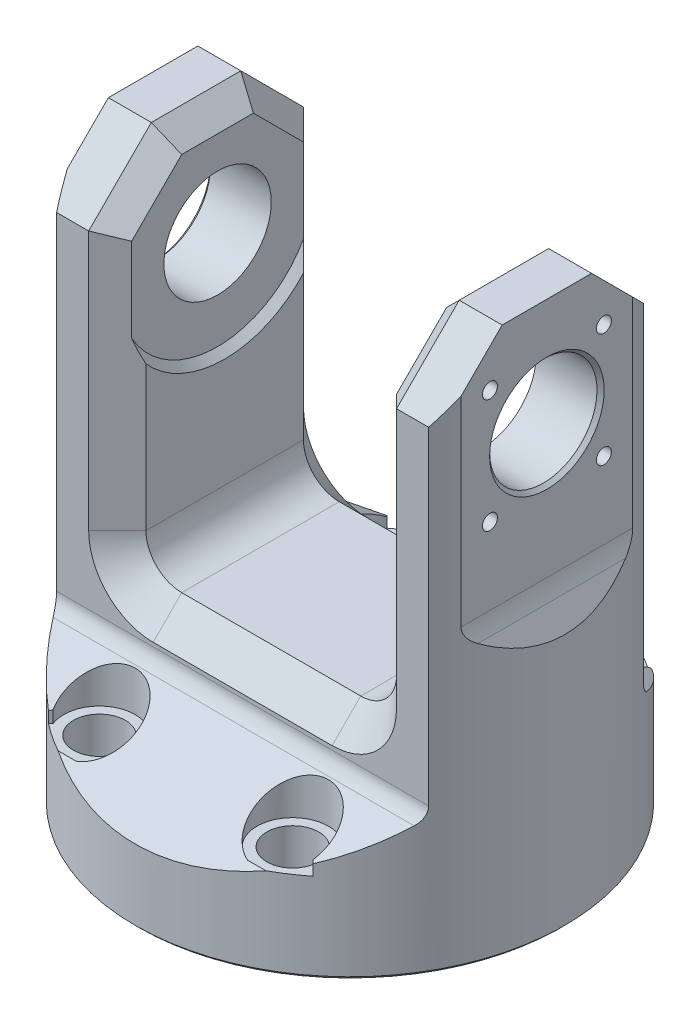
from build123d import *

# Parameters (mm, degrees)
SKETCH1_R               = 60
BOSS_EXTRUDE1_DEPTH     = 150
CUT_EXTRUDE1_DEPTH      = 173.336879396
CUT_EXTRUDE1_DEPTH_BACK = 173.336879396
SKETCH2_W               = 70
SKETCH2_H               = 100
FILLET1_R               = 10
CUT_EXTRUDE2_DEPTH      = 173.336879553
CUT_EXTRUDE2_DEPTH_BACK = 173.336879553
SKETCH3_OUTSIDE_W       = 167.3
SKETCH3_OUTSIDE_H       = 197.3
CUT_EXTRUDE3_DEPTH      = 199.305320239
CUT_EXTRUDE3_DEPTH_BACK = 199.305320239
SKETCH4_R               = 15
CIRPATTERN1_COUNT       = 4
CHAMFER1_SIZE           = 8
HOLE1_D                 = 14.5
HOLE1_CBORE_D           = 20
HOLE1_CBORE_DEPTH       = 25
CHAMFER3_SIZE           = 1
CHAMFER4_SIZE           = 1


with BuildPart() as part:
    # Sketch1 → Boss-Extrude1 (new body)
    with BuildSketch(Plane(origin=(0, 0, 0), x_dir=(1, 0, 0), z_dir=(0, 1, 0))):
        with Locations(Location((0, 0, 0), (0, 0, 270))):
            Circle(SKETCH1_R)
    extrude(amount=BOSS_EXTRUDE1_DEPTH)

    # Sketch2 → Cut-Extrude1 (cut, two sides: drawn at the far end of the back side and taken through both)
    with BuildSketch(Plane.XY.offset(-CUT_EXTRUDE1_DEPTH_BACK)):
        with Locations((0, 100)):
            Rectangle(SKETCH2_W, SKETCH2_H)
        Polygon((-55, 150), (-55, 80), (-60, 71.339745962), (-60, 150), align=None)
        Polygon((55, 80), (60, 71.339745962), (60, 150), (55, 150), align=None)
    extrude(amount=CUT_EXTRUDE1_DEPTH + CUT_EXTRUDE1_DEPTH_BACK, mode=Mode.SUBTRACT)

    # Fillet1
    fillet1_edges = [part.edges().sort_by_distance(p)[0] for p in [
        (-35, 50, 0),
        (35, 50, 0),
        (-55, 80, 0),
        (55, 80, 0),
    ]]
    fillet(fillet1_edges, radius=FILLET1_R)

    # Sketch3 outside → Cut-Extrude2 (cut, two sides: drawn at the far end of the back side and taken through both)
    with BuildSketch(Plane(origin=(0, 0, 0), x_dir=(0, 0, -1), z_dir=(1, 0, 0)).offset(-CUT_EXTRUDE2_DEPTH_BACK)):
        with Locations((0, 75)):
            Rectangle(SKETCH3_OUTSIDE_W, SKETCH3_OUTSIDE_H)
        with BuildLine():
            Line((-12.5, 150), (-30, 132.5))
            Line((-30, 132.5), (-30, 40.886751346))
            ThreePointArc((-30, 40.886751346), (-30.669872981, 38.386751346), (-32.5, 36.556624327))
            Line((-32.5, 36.556624327), (-60, 20.679491924))
            Line((-60, 20.679491924), (-60, 0))
            Line((-60, 0), (60, 0))
            Line((60, 0), (60, 20.679491924))
            Line((60, 20.679491924), (32.5, 36.556624327))
            ThreePointArc((32.5, 36.556624327), (30.669872981, 38.386751346), (30, 40.886751346))
            Line((30, 40.886751346), (30, 132.5))
            Line((30, 132.5), (12.5, 150))
            Line((12.5, 150), (-12.5, 150))
        make_face(mode=Mode.SUBTRACT)
    extrude(amount=CUT_EXTRUDE2_DEPTH + CUT_EXTRUDE2_DEPTH_BACK, mode=Mode.SUBTRACT)

    # Sketch4 → Cut-Extrude3 (cut, two sides: drawn at the far end of the back side and taken through both)
    with BuildSketch(Plane(origin=(55, 0, 0), x_dir=(0, 0, -1), z_dir=(1, 0, 0)).offset(-CUT_EXTRUDE3_DEPTH_BACK)):
        with Locations(Location((0, 120, 0), (0, 0, 90))):
            Circle(SKETCH4_R)
    extrude(amount=CUT_EXTRUDE3_DEPTH + CUT_EXTRUDE3_DEPTH_BACK, mode=Mode.SUBTRACT)

    # Sketch6 → M5 Tapped Hole1 (revolve, cut)
    with BuildSketch(Plane(origin=(55, 135.909902577, -15.909902577), x_dir=(0, 0, -1), z_dir=(0, 1, 0))):
        Polygon((0, 0), (0, 17.2618073), (2.1, 16), (2.1, 0), align=None)
    m5_tapped_hole1 = revolve(axis=Axis((61.35, 135.909902577, -15.909902577), (-1, 0, 0)), mode=Mode.SUBTRACT)

    # CirPattern1: M5 Tapped Hole1 ×4 about axis
    cirpattern1_axis = Axis((0, 120, 0), (1, 0, 0))
    for i in range(1, CIRPATTERN1_COUNT):
        add(m5_tapped_hole1.rotate(cirpattern1_axis, i * 360 / CIRPATTERN1_COUNT), mode=Mode.SUBTRACT)

    # Mirror1: M5 Tapped Hole1 across plane
    add(m5_tapped_hole1.mirror(Plane(origin=(0, 0, 0), x_dir=(0, 0, 1), z_dir=(1, 0, 0))), mode=Mode.SUBTRACT)

    # Mirror1 copy 1 sketch → Mirror1 copy 1 (revolve, cut)
    with BuildSketch(Plane(origin=(-55, 135.909902577, 15.909902577), x_dir=(0, 1, 0), z_dir=(0, 0, 1))):
        Polygon((0, 0), (0, -17.2618073), (2.1, -16), (2.1, 0), align=None)
    revolve(axis=Axis((-61.35, 135.909902577, 15.909902577), (-1, 0, 0)), mode=Mode.SUBTRACT)

    # Mirror1 copy 2 sketch → Mirror1 copy 2 (revolve, cut)
    with BuildSketch(Plane(origin=(-55, 104.090097423, 15.909902577), x_dir=(0, 0, 1), z_dir=(0, -1, 0))):
        Polygon((0, 0), (0, -17.2618073), (2.1, -16), (2.1, 0), align=None)
    revolve(axis=Axis((-61.35, 104.090097423, 15.909902577), (-1, 0, 0)), mode=Mode.SUBTRACT)

    # Mirror1 copy 3 sketch → Mirror1 copy 3 (revolve, cut)
    with BuildSketch(Plane(origin=(-55, 104.090097423, -15.909902577), x_dir=(0, -1, 0), z_dir=(0, 0, -1))):
        Polygon((0, 0), (0, -17.2618073), (2.1, -16), (2.1, 0), align=None)
    revolve(axis=Axis((-61.35, 104.090097423, -15.909902577), (-1, 0, 0)), mode=Mode.SUBTRACT)

    # Chamfer1
    chamfer1_edges = [part.edges().sort_by_distance(p)[0] for p in [
        (32.071067812, 52.928932188, 30),
        (32.071067812, 52.928932188, -30),
        (-35, 150, 0),
        (35, 150, 0),
        (35, 141.25, -21.25),
        (-35, 141.25, -21.25),
        (35, 141.25, 21.25),
        (-35, 141.25, 21.25),
        (-35, 96.25, -30),
        (-32.071067812, 52.928932188, -30),
        (0, 50, -30),
        (35, 96.25, -30),
        (-32.071067812, 52.928932188, 30),
        (-35, 96.25, 30),
        (35, 96.25, 30),
        (0, 50, 30),
    ]]
    chamfer(chamfer1_edges, length=CHAMFER1_SIZE)

    # Hole1 (through all)
    with Locations(Plane(origin=(-27, 50, -43), x_dir=(1, 0, 0), z_dir=(0, 1, 0))):
        with Locations((0, 0), (54, 0), (0, -86), (54, -86)):
            CounterBoreHole(HOLE1_D / 2, HOLE1_CBORE_D / 2, HOLE1_CBORE_DEPTH)

    # Chamfer3
    chamfer3_edges = [part.edges().sort_by_distance(p)[0] for p in [
        (0, 0, -60),
    ]]
    chamfer(chamfer3_edges, length=CHAMFER3_SIZE)

    # Chamfer4
    chamfer4_edges = [part.edges().sort_by_distance(p)[0] for p in [
        (55, 105, 0),
        (-55, 105, 0),
    ]]
    chamfer(chamfer4_edges, length=CHAMFER4_SIZE)

    # Chamfer5
    # the kernel refuses this chamfer: 2 mm, written as the material it takes off along each edge
    with BuildSketch(Plane(origin=(35.377389831, 32.524460395, -48.460708711), x_dir=(0.7977683815580907, 0, 0.6029640199764695), z_dir=(0, -1, 0))) as chamfer5_piece_1:
        with BuildLine():
            Line((1.994201413, 0), (1.846539445, 0.888707135))
            ThreePointArc((1.846539445, 0.888707135), (0.956280866, 0.401837503), (0, 0))
            ThreePointArc((0, 0), (1.003653566, -0.008285296), (1.994201413, 0))
        make_face()
    extrude(amount=7.524460395, mode=Mode.SUBTRACT)
    with BuildSketch(Plane(origin=(-35.377389831, 32.524460395, -48.460708711), x_dir=(-0.7977683815580952, 0, 0.602964019976464), z_dir=(0, -1, 0))) as chamfer5_piece_2:
        with BuildLine():
            Line((1.994201413, 0), (1.846539445, -0.888707135))
            ThreePointArc((1.846539445, -0.888707135), (0.956280866, -0.401837503), (0, 0))
            ThreePointArc((0, 0), (1.003653566, 0.008285296), (1.994201413, 0))
        make_face()
    extrude(amount=7.524460395, mode=Mode.SUBTRACT)

    # Chamfer6
    # the kernel refuses this chamfer: 2 mm, written as the material it takes off along each edge
    with BuildSketch(Plane(origin=(-35.377389831, 32.524460395, 48.460708711), x_dir=(-0.45735909504580285, 0, -0.8892821026979484), z_dir=(0, -1, 0))) as chamfer6_piece_1:
        with BuildLine():
            Line((2.049270186, 0), (1.79691853, -0.864825457))
            ThreePointArc((1.79691853, -0.864825457), (0.900770777, -0.442720154), (0, 0))
            ThreePointArc((0, 0), (1.035942557, -0.052625969), (2.049270186, 0))
        make_face()
    extrude(amount=7.524460395, mode=Mode.SUBTRACT)
    with BuildSketch(Plane(origin=(35.377389831, 32.524460395, 48.460708711), x_dir=(0.45735909504580835, 0, -0.8892821026979455), z_dir=(0, -1, 0))) as chamfer6_piece_2:
        with BuildLine():
            Line((2.049270186, 0), (1.79691853, 0.864825457))
            ThreePointArc((1.79691853, 0.864825457), (0.900770777, 0.442720154), (0, 0))
            ThreePointArc((0, 0), (1.035942557, 0.052625969), (2.049270186, 0))
        make_face()
    extrude(amount=7.524460395, mode=Mode.SUBTRACT)

    # Sketch12 → Cut-Revolve1 (revolve, cut)
    with BuildSketch(Plane.XY):
        Polygon((37, 147.5), (37, 120), (32, 120), (32, 152.5), align=None)
    cut_revolve1 = revolve(axis=Axis((37, 120, 0), (-1, 0, 0)), mode=Mode.SUBTRACT)

    # Mirror2: Cut-Revolve1 across plane
    add(cut_revolve1.mirror(Plane(origin=(0, 0, 0), x_dir=(0, 0, 1), z_dir=(1, 0, 0))), mode=Mode.SUBTRACT)


solid = part.part
